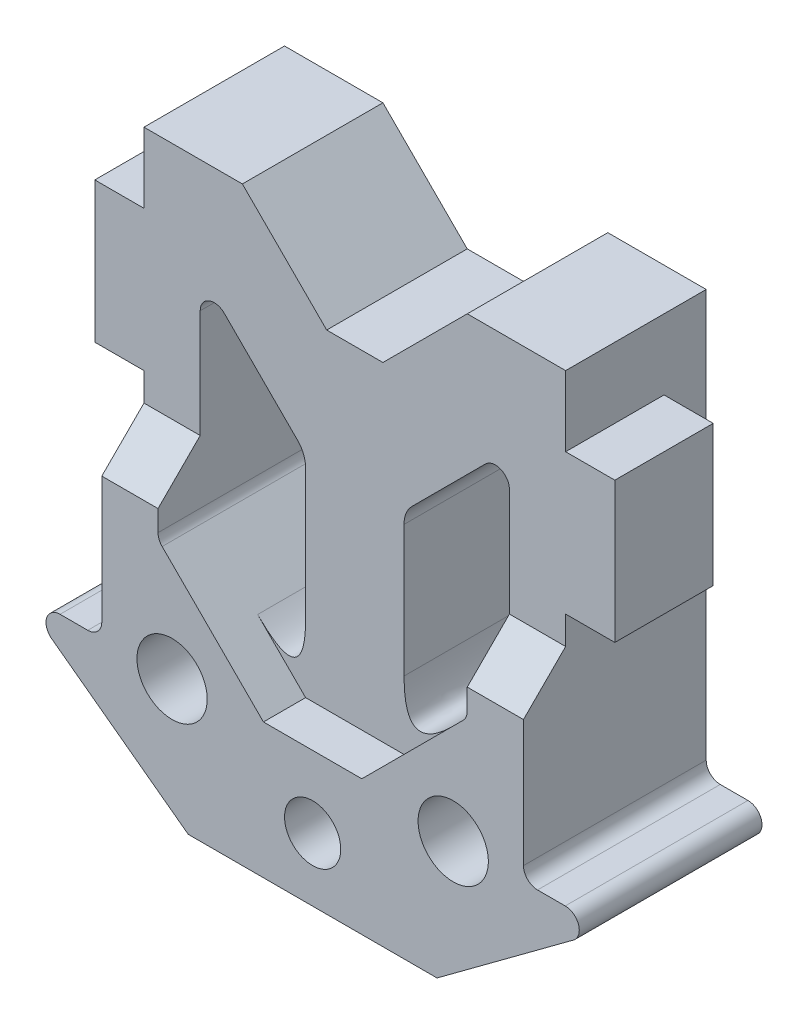
from build123d import *

# Parameters (mm, degrees)
ESQUISSE1_W             = 2.5
ESQUISSE1_H             = 10
BOSS_EXTRU_1_DEPTH      = 7
BOSS_EXTRU_2_DEPTH      = 3
BOSS_EXTRU_2_DEPTH_BACK = 10
ENL_V_MAT_EXTRU_1_REACH = 44.024
ESQUISSE4_4_W           = 7
ESQUISSE4_4_H           = 9.399494937
ENL_V_MAT_EXTRU_4_DEPTH = 3
ENL_V_START             = -13
ESQUISSE4_W             = 7
ESQUISSE4_H             = 9.399494937
ENL_V_MAT_EXTRU_2_DEPTH = 3
CHANFREIN1_SIZE         = 3
CONG_1_R                = 1
ESQUISSE5_R             = 4.8
ENL_V_MAT_EXTRU_5_DEPTH = 1
ESQUISSE6_R             = 2.5
ESQUISSE6_R_2           = 2
ENL_V_MAT_EXTRU_6_DEPTH = 42.047043387
CHANFREIN2_SIZE         = 1
SKETCH_1_W              = 7
SKETCH_1_H              = 5
CUT_EXTRUDE_1_DEPTH     = 1
SKETCH_2_W              = 7
SKETCH_2_H              = 5
CUT_EXTRUDE_2_DEPTH     = 1
EXTRUDE_1_DEPTH         = 3
FILLET_1_R              = 3
FILLET_2_R              = 1
FILLET_3_R              = 2
CUT_EXTRUDE_START       = -30
SKETCH_5_R              = 3
CUT_EXTRUDE_3_DEPTH     = 30


# Some blends are built 0.0001 mm under size
with BuildPart() as part:
    # Esquisse1 → Boss.-Extru.1 (new body)
    with BuildSketch(Plane.XY):
        Polygon((-8, 6), (-16, 6), (-16, 1), (-16, -9), (-16, -24), (-21, -24), (-7.5, -34), (0, -34), (0, 0), (-2, 0), align=None)
        Polygon((2, 0), (0, 0), (0, -34), (7.5, -34), (21, -24), (16, -24), (16, -9), (16, 1), (16, 6), (8, 6), align=None)
        with Locations((17.25, -4)):
            Rectangle(ESQUISSE1_W, ESQUISSE1_H)
        with Locations((-17.25, -4)):
            Rectangle(ESQUISSE1_W, ESQUISSE1_H)
    extrude(amount=BOSS_EXTRU_1_DEPTH)

    # Esquisse2 → Boss.-Extru.2 (add, two sides: drawn at the far end of the back side and taken through both)
    with BuildSketch(Plane.XY.offset(7).offset(-BOSS_EXTRU_2_DEPTH_BACK)):
        Polygon((16, -14), (-16, -14), (-16, -24), (-21, -24), (-7.5, -34), (7.5, -34), (21, -24), (16, -24), align=None)
    extrude(amount=BOSS_EXTRU_2_DEPTH + BOSS_EXTRU_2_DEPTH_BACK)

    # Esquisse3 → Enlèv. mat.-Extru.1 (cut, up to next)
    with BuildSketch(Plane(origin=(0, 0, -3), x_dir=(-1, 0, 0), z_dir=(0, 0, -1)), mode=Mode.PRIVATE) as enl_v_mat_extru_1_sk1:
        Polygon((-11, -0.899494937), (-3.5, -8.399494937), (-3.5, -23.399494937), (-11, -15.899494937), align=None)
    enl_v_mat_extru_1_tool1 = extrude(enl_v_mat_extru_1_sk1.sketch, amount=-ENL_V_MAT_EXTRU_1_REACH, mode=Mode.PRIVATE) & part.part
    # Esquisse3 → Enlèv. mat.-Extru.1 (cut, up to next)
    with BuildSketch(Plane(origin=(0, 0, -3), x_dir=(-1, 0, 0), z_dir=(0, 0, -1)), mode=Mode.PRIVATE) as enl_v_mat_extru_1_sk2:
        Polygon((11, -15.899494937), (11, -0.899494937), (3.5, -8.399494937), (3.5, -23.399494937), align=None)
    enl_v_mat_extru_1_tool2 = extrude(enl_v_mat_extru_1_sk2.sketch, amount=-ENL_V_MAT_EXTRU_1_REACH, mode=Mode.PRIVATE) & part.part
    add(enl_v_mat_extru_1_tool1.solids().sort_by_distance((7.25, -12.149495, -3))[0], mode=Mode.SUBTRACT)
    add(enl_v_mat_extru_1_tool2.solids().sort_by_distance((-7.25, -12.149495, -3))[0], mode=Mode.SUBTRACT)

    # Esquisse4<4> → Enlèv. mat.-Extru.4 (cut)
    with BuildSketch(Plane(origin=(0, 0, -3), x_dir=(-1, 0, 0), z_dir=(0, 0, -1))):
        with Locations((0, -18.699747469)):
            Rectangle(ESQUISSE4_4_W, ESQUISSE4_4_H)
    extrude(amount=-ENL_V_MAT_EXTRU_4_DEPTH, mode=Mode.SUBTRACT)

    # Esquisse4 → Enlèv. mat.-Extru.2 (cut)
    with BuildSketch(Plane(origin=(0, 0, -3), x_dir=(-1, 0, 0), z_dir=(0, 0, -1)).offset(ENL_V_START)):
        with Locations((0, -18.699747469)):
            Rectangle(ESQUISSE4_W, ESQUISSE4_H)
    extrude(amount=ENL_V_MAT_EXTRU_2_DEPTH, mode=Mode.SUBTRACT)

    # Chanfrein1
    chanfrein1_edges = [part.edges().sort_by_distance(p)[0] for p in [
        (-13.5, -14, 0),
        (-13.5, -14, 7),
        (13.5, -14, 0),
        (13.5, -14, 7),
    ]]
    chamfer(chanfrein1_edges, length=CHANFREIN1_SIZE - 0.0001)  # a hair under: the kernel refuses the full size

    # Congé1
    cong_1_edges = [part.edges().sort_by_distance(p)[0] for p in [
        (11, -15.899494937, 3.5),
        (11, -0.899494937, 3.5),
        (-11, -0.899494937, 3.5),
        (-11, -15.899494937, 3.5),
        (-21, -24, 3.5),
        (21, -24, 3.5),
    ]]
    fillet(cong_1_edges, radius=CONG_1_R)

    # Esquisse5 → Enlèv. mat.-Extru.5 (cut)
    with BuildSketch(Plane.XZ.offset(34)):
        with Locations(Location((0, 3.5, 0), (0, 0, 270))):
            Circle(ESQUISSE5_R)
    extrude(amount=-ENL_V_MAT_EXTRU_5_DEPTH, mode=Mode.SUBTRACT)

    # Esquisse6 → Enlèv. mat.-Extru.6 (cut, through all)
    with BuildSketch(Plane.XY.offset(10)):
        with Locations((-10, -24)):
            Circle(ESQUISSE6_R)
        with Locations((0, -28.5)):
            Circle(ESQUISSE6_R_2)
        with Locations(Location((10, -24, 0), (0, 0, 180))):
            Circle(ESQUISSE6_R)
    extrude(amount=-ENL_V_MAT_EXTRU_6_DEPTH, mode=Mode.SUBTRACT)

    # Chanfrein2
    chanfrein2_edges = [part.edges().sort_by_distance(p)[0] for p in [
        (0, -34, -3),
        (0, -34, 10),
    ]]
    chamfer(chanfrein2_edges, length=CHANFREIN2_SIZE)

    # Эскиз1 → Вырез-Вытянуть1 (cut)
    with BuildSketch(Plane(origin=(16, 0, 0), x_dir=(0, 0, -1), z_dir=(1, 0, 0))):
        with Locations((-3.5, 3.5)):
            Rectangle(SKETCH_1_W, SKETCH_1_H)
        Polygon((-10, -24), (3, -24), (3, -14), (0, -11), (0, -9), (-7, -9), (-7, -11), (-10, -14), align=None)
    extrude(amount=-CUT_EXTRUDE_1_DEPTH, mode=Mode.SUBTRACT)

    # Эскиз2 → Вырез-Вытянуть2 (cut)
    with BuildSketch(Plane.ZY.offset(16)):
        with Locations((3.5, 3.5)):
            Rectangle(SKETCH_2_W, SKETCH_2_H)
        Polygon((10, -24), (10, -14), (7, -11), (7, -9), (0, -9), (0, -11), (-3, -14), (-3, -24), align=None)
    extrude(amount=-CUT_EXTRUDE_2_DEPTH, mode=Mode.SUBTRACT)

    # Эскиз4 → Бобышка-Вытянуть1 (add)
    with BuildSketch(Plane(origin=(0, 0, 0), x_dir=(-1, 0, 0), z_dir=(0, 0, -1))):
        with BuildLine():
            Line((15, -14), (15, -11))
            Line((15, -11), (15, -9))
            Line((15, -9), (15, 6))
            Line((15, 6), (8, 6))
            Line((8, 6), (2, 0))
            Line((2, 0), (-2, 0))
            Line((-2, 0), (-8, 6))
            Line((-8, 6), (-15, 6))
            Line((-15, 6), (-15, -9))
            Line((-15, -9), (-15, -11))
            Line((-15, -11), (-15, -14))
            Line((-15, -14), (-11, -14))
            Line((-11, -14), (-11, -11))
            Line((-11, -11), (-11, -3.313708499))
            ThreePointArc((-11, -3.313708499), (-10.382683432, -2.389828966), (-9.292893219, -2.606601718))
            Line((-9.292893219, -2.606601718), (-3.5, -8.399494937))
            Line((-3.5, -8.399494937), (-3.5, -23.399494937))
            Line((-3.5, -23.399494937), (3.5, -23.399494937))
            Line((3.5, -23.399494937), (3.5, -8.399494937))
            Line((3.5, -8.399494937), (9.292893219, -2.606601718))
            ThreePointArc((9.292893219, -2.606601718), (10.382683432, -2.389828966), (11, -3.313708499))
            Line((11, -3.313708499), (11, -11))
            Line((11, -11), (11, -14))
            Line((11, -14), (15, -14))
        make_face()
    extrude(amount=EXTRUDE_1_DEPTH)

    # Скругление1
    fillet_1_edges = [part.edges().sort_by_distance(p)[0] for p in [
        (-7.5, -34, 3.5),
        (7.5, -34, 3.5),
    ]]
    fillet(fillet_1_edges, radius=FILLET_1_R)

    # Скругление2
    fillet_2_edges = [part.edges().sort_by_distance(p)[0] for p in [
        (15, -24, 3.5),
        (-15, -24, 3.5),
    ]]
    fillet(fillet_2_edges, radius=FILLET_2_R)

    # Скругление3
    fillet_3_edges = [part.edges().sort_by_distance(p)[0] for p in [
        (3.5, -8.399494937, 2),
        (-3.5, -8.399494937, 2),
    ]]
    fillet(fillet_3_edges, radius=FILLET_3_R)

    # Скругление4
    # a fillet whose section is not a circle: 2 mm, written as the material it adds along each edge
    with BuildSketch(Plane(origin=(-3.5, -23.399494937, 7), x_dir=(0, 1, 0), z_dir=(0, 0, -1)), Plane(origin=(3.5, -23.399494937, -3), x_dir=(0, 1, 0), z_dir=(0, 0, 1))) as fillet_4_piece_1:
        with BuildLine():
            Bezier((4.828427125, 0), (0, 0), (3.414213562, -3.414213562), weights=[1, 1, 1])
            Line((3.414213562, -3.414213562), (0, 0))
            Line((0, 0), (4.828427125, 0))
        make_face()
    extrude(amount=10)

    # Эскиз5 → Вырез-Вытянуть3 (cut)
    with BuildSketch(Plane.ZY.offset(15).offset(CUT_EXTRUDE_START)):
        with Locations((-3.39031082, -5.412141647)):
            Circle(SKETCH_5_R)
    extrude(amount=CUT_EXTRUDE_3_DEPTH, mode=Mode.SUBTRACT)


solid = part.part
